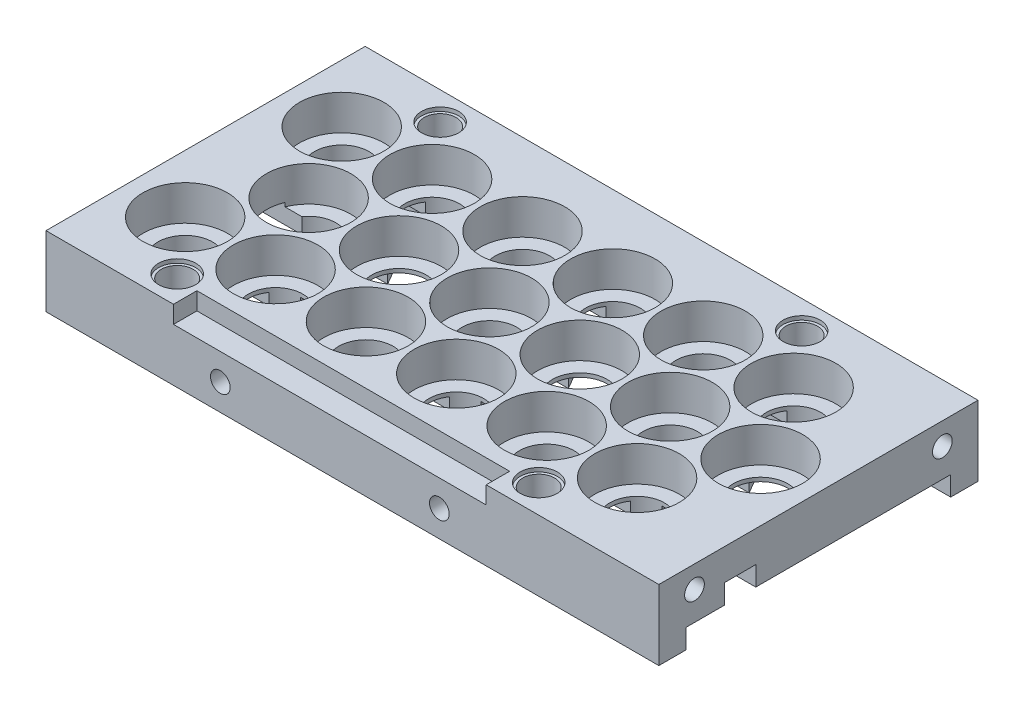
from build123d import *

# Parameters (mm, degrees)
BOSS_EXTRUDE2_DEPTH      = 11
BOSS_EXTRUDE2_DEPTH_BACK = 2
SKETCH1_W                = 156.975
SKETCH1_H                = 81.746976195
SKETCH1_R                = 10.825
BOSS_EXTRUDE3_DEPTH      = 2
BOSS_EXTRUDE3_DEPTH_BACK = 2
SKETCH1_3_R              = 10.825
SKETCH1_3_R_2            = 7
CUT_EXTRUDE3_REACH       = 157.2
SKETCH9_R                = 4.0767
SKETCH10_R               = 4.7625
CUT_EXTRUDE4_DEPTH       = 1
SKETCH13_R               = 6.5
BOSS_EXTRUDE7_DEPTH      = 5
CUT_EXTRUDE1_DEPTH       = 3
SKETCH19_W               = 80.1
SKETCH19_H               = 4.475
CUT_EXTRUDE6_DEPTH       = 6
SKETCH20_R               = 2.525
CUT_EXTRUDE7_DEPTH       = 6.604
SKETCH22_R               = 2.525
CUT_EXTRUDE8_DEPTH       = 6.604
SKETCH26_R               = 1.9431
CUT_EXTRUDE9_DEPTH       = 5
CUT_EXTRUDE10_DEPTH      = 5
SKETCH28_R               = 1.9431
CUT_EXTRUDE11_DEPTH      = 5


with BuildPart() as part:
    # Sketch1 → Boss-Extrude2 (new, two sides: drawn at the far end of the back side and taken through both)
    with BuildSketch(Plane(origin=(0, 0, 0), x_dir=(1, 0, 0), z_dir=(0, 1, 0)).offset(-BOSS_EXTRUDE2_DEPTH_BACK)):
        with Locations((63.6625, -20.048488098)):
            Rectangle(SKETCH1_W, SKETCH1_H)
        with Locations((0, -40.096976195)):
            Circle(SKETCH1_R, mode=Mode.SUBTRACT)
        with Locations((23.15, -40.096976195)):
            Circle(SKETCH1_R, mode=Mode.SUBTRACT)
        with Locations((46.3, -40.096976195)):
            Circle(SKETCH1_R, mode=Mode.SUBTRACT)
        with Locations((69.45, -40.096976195)):
            Circle(SKETCH1_R, mode=Mode.SUBTRACT)
        with Locations((92.6, -40.096976195)):
            Circle(SKETCH1_R, mode=Mode.SUBTRACT)
        with Locations((115.75, -40.096976195)):
            Circle(SKETCH1_R, mode=Mode.SUBTRACT)
        with Locations((11.575, -20.048488098)):
            Circle(SKETCH1_R, mode=Mode.SUBTRACT)
        Circle(SKETCH1_R, mode=Mode.SUBTRACT)
        with Locations((23.15, 0)):
            Circle(SKETCH1_R, mode=Mode.SUBTRACT)
        with Locations((34.725, -20.048488098)):
            Circle(SKETCH1_R, mode=Mode.SUBTRACT)
        with Locations((57.875, -20.048488098)):
            Circle(SKETCH1_R, mode=Mode.SUBTRACT)
        with Locations((46.3, 0)):
            Circle(SKETCH1_R, mode=Mode.SUBTRACT)
        with Locations((81.025, -20.048488098)):
            Circle(SKETCH1_R, mode=Mode.SUBTRACT)
        with Locations((69.45, 0)):
            Circle(SKETCH1_R, mode=Mode.SUBTRACT)
        with Locations((92.6, 0)):
            Circle(SKETCH1_R, mode=Mode.SUBTRACT)
        with Locations((104.175, -20.048488098)):
            Circle(SKETCH1_R, mode=Mode.SUBTRACT)
        with Locations((127.325, -20.048488098)):
            Circle(SKETCH1_R, mode=Mode.SUBTRACT)
        with Locations((115.75, 0)):
            Circle(SKETCH1_R, mode=Mode.SUBTRACT)
    extrude(amount=BOSS_EXTRUDE2_DEPTH + BOSS_EXTRUDE2_DEPTH_BACK)

    # Sketch1<3> → Boss-Extrude3 (add, two sides: drawn at the far end of the back side and taken through both)
    # profile 1 of 18: a face of its own
    with BuildSketch(Plane(origin=(0, 0, 0), x_dir=(1, 0, 0), z_dir=(0, 1, 0)).offset(-BOSS_EXTRUDE3_DEPTH_BACK)):
        Circle(SKETCH1_3_R)
        Circle(SKETCH1_3_R_2, mode=Mode.SUBTRACT)
    # profile 2 of 18: a face of its own
    with BuildSketch(Plane(origin=(0, 0, 0), x_dir=(1, 0, 0), z_dir=(0, 1, 0)).offset(-BOSS_EXTRUDE3_DEPTH_BACK)):
        with Locations((11.575, -20.048488098)):
            Circle(SKETCH1_3_R)
        with Locations((11.575, -20.048488098)):
            Circle(SKETCH1_3_R_2, mode=Mode.SUBTRACT)
    # profile 3 of 18: a face of its own
    with BuildSketch(Plane(origin=(0, 0, 0), x_dir=(1, 0, 0), z_dir=(0, 1, 0)).offset(-BOSS_EXTRUDE3_DEPTH_BACK)):
        with Locations((0, -40.096976195)):
            Circle(SKETCH1_3_R)
        with Locations((0, -40.096976195)):
            Circle(SKETCH1_3_R_2, mode=Mode.SUBTRACT)
    # profile 4 of 18: a face of its own
    with BuildSketch(Plane(origin=(0, 0, 0), x_dir=(1, 0, 0), z_dir=(0, 1, 0)).offset(-BOSS_EXTRUDE3_DEPTH_BACK)):
        with Locations((23.15, 0)):
            Circle(SKETCH1_3_R)
        with Locations((23.15, 0)):
            Circle(SKETCH1_3_R_2, mode=Mode.SUBTRACT)
    # profile 5 of 18: a face of its own
    with BuildSketch(Plane(origin=(0, 0, 0), x_dir=(1, 0, 0), z_dir=(0, 1, 0)).offset(-BOSS_EXTRUDE3_DEPTH_BACK)):
        with Locations((34.725, -20.048488098)):
            Circle(SKETCH1_3_R)
        with Locations((34.725, -20.048488098)):
            Circle(SKETCH1_3_R_2, mode=Mode.SUBTRACT)
    # profile 6 of 18: a face of its own
    with BuildSketch(Plane(origin=(0, 0, 0), x_dir=(1, 0, 0), z_dir=(0, 1, 0)).offset(-BOSS_EXTRUDE3_DEPTH_BACK)):
        with Locations((23.15, -40.096976195)):
            Circle(SKETCH1_3_R)
        with Locations((23.15, -40.096976195)):
            Circle(SKETCH1_3_R_2, mode=Mode.SUBTRACT)
    # profile 7 of 18: a face of its own
    with BuildSketch(Plane(origin=(0, 0, 0), x_dir=(1, 0, 0), z_dir=(0, 1, 0)).offset(-BOSS_EXTRUDE3_DEPTH_BACK)):
        with Locations((46.3, 0)):
            Circle(SKETCH1_3_R)
        with Locations((46.3, 0)):
            Circle(SKETCH1_3_R_2, mode=Mode.SUBTRACT)
    # profile 8 of 18: a face of its own
    with BuildSketch(Plane(origin=(0, 0, 0), x_dir=(1, 0, 0), z_dir=(0, 1, 0)).offset(-BOSS_EXTRUDE3_DEPTH_BACK)):
        with Locations((57.875, -20.048488098)):
            Circle(SKETCH1_3_R)
        with Locations((57.875, -20.048488098)):
            Circle(SKETCH1_3_R_2, mode=Mode.SUBTRACT)
    # profile 9 of 18: a face of its own
    with BuildSketch(Plane(origin=(0, 0, 0), x_dir=(1, 0, 0), z_dir=(0, 1, 0)).offset(-BOSS_EXTRUDE3_DEPTH_BACK)):
        with Locations((46.3, -40.096976195)):
            Circle(SKETCH1_3_R)
        with Locations((46.3, -40.096976195)):
            Circle(SKETCH1_3_R_2, mode=Mode.SUBTRACT)
    # profile 10 of 18: a face of its own
    with BuildSketch(Plane(origin=(0, 0, 0), x_dir=(1, 0, 0), z_dir=(0, 1, 0)).offset(-BOSS_EXTRUDE3_DEPTH_BACK)):
        with Locations((69.45, 0)):
            Circle(SKETCH1_3_R)
        with Locations((69.45, 0)):
            Circle(SKETCH1_3_R_2, mode=Mode.SUBTRACT)
    # profile 11 of 18: a face of its own
    with BuildSketch(Plane(origin=(0, 0, 0), x_dir=(1, 0, 0), z_dir=(0, 1, 0)).offset(-BOSS_EXTRUDE3_DEPTH_BACK)):
        with Locations((81.025, -20.048488098)):
            Circle(SKETCH1_3_R)
        with Locations((81.025, -20.048488098)):
            Circle(SKETCH1_3_R_2, mode=Mode.SUBTRACT)
    # profile 12 of 18: a face of its own
    with BuildSketch(Plane(origin=(0, 0, 0), x_dir=(1, 0, 0), z_dir=(0, 1, 0)).offset(-BOSS_EXTRUDE3_DEPTH_BACK)):
        with Locations((69.45, -40.096976195)):
            Circle(SKETCH1_3_R)
        with Locations((69.45, -40.096976195)):
            Circle(SKETCH1_3_R_2, mode=Mode.SUBTRACT)
    # profile 13 of 18: a face of its own
    with BuildSketch(Plane(origin=(0, 0, 0), x_dir=(1, 0, 0), z_dir=(0, 1, 0)).offset(-BOSS_EXTRUDE3_DEPTH_BACK)):
        with Locations((92.6, 0)):
            Circle(SKETCH1_3_R)
        with Locations((92.6, 0)):
            Circle(SKETCH1_3_R_2, mode=Mode.SUBTRACT)
    # profile 14 of 18: a face of its own
    with BuildSketch(Plane(origin=(0, 0, 0), x_dir=(1, 0, 0), z_dir=(0, 1, 0)).offset(-BOSS_EXTRUDE3_DEPTH_BACK)):
        with Locations((104.175, -20.048488098)):
            Circle(SKETCH1_3_R)
        with Locations((104.175, -20.048488098)):
            Circle(SKETCH1_3_R_2, mode=Mode.SUBTRACT)
    # profile 15 of 18: a face of its own
    with BuildSketch(Plane(origin=(0, 0, 0), x_dir=(1, 0, 0), z_dir=(0, 1, 0)).offset(-BOSS_EXTRUDE3_DEPTH_BACK)):
        with Locations((92.6, -40.096976195)):
            Circle(SKETCH1_3_R)
        with Locations((92.6, -40.096976195)):
            Circle(SKETCH1_3_R_2, mode=Mode.SUBTRACT)
    # profile 16 of 18: a face of its own
    with BuildSketch(Plane(origin=(0, 0, 0), x_dir=(1, 0, 0), z_dir=(0, 1, 0)).offset(-BOSS_EXTRUDE3_DEPTH_BACK)):
        with Locations((115.75, 0)):
            Circle(SKETCH1_3_R)
        with Locations((115.75, 0)):
            Circle(SKETCH1_3_R_2, mode=Mode.SUBTRACT)
    # profile 17 of 18: a face of its own
    with BuildSketch(Plane(origin=(0, 0, 0), x_dir=(1, 0, 0), z_dir=(0, 1, 0)).offset(-BOSS_EXTRUDE3_DEPTH_BACK)):
        with Locations((127.325, -20.048488098)):
            Circle(SKETCH1_3_R)
        with Locations((127.325, -20.048488098)):
            Circle(SKETCH1_3_R_2, mode=Mode.SUBTRACT)
    # profile 18 of 18: a face of its own
    with BuildSketch(Plane(origin=(0, 0, 0), x_dir=(1, 0, 0), z_dir=(0, 1, 0)).offset(-BOSS_EXTRUDE3_DEPTH_BACK)):
        with Locations((115.75, -40.096976195)):
            Circle(SKETCH1_3_R)
        with Locations((115.75, -40.096976195)):
            Circle(SKETCH1_3_R_2, mode=Mode.SUBTRACT)
    extrude(amount=BOSS_EXTRUDE3_DEPTH + BOSS_EXTRUDE3_DEPTH_BACK)

    # Sketch9 → Cut-Extrude3 (cut, up to next)
    with BuildSketch(Plane(origin=(0, 11, 0), x_dir=(1, 0, 0), z_dir=(0, 1, 0)), mode=Mode.PRIVATE) as cut_extrude3_sk1:
        with Locations((11.575, 13.625)):
            Circle(SKETCH9_R)
    cut_extrude3_tool1 = extrude(cut_extrude3_sk1.sketch, amount=-CUT_EXTRUDE3_REACH, mode=Mode.PRIVATE) & part.part
    # Sketch9 → Cut-Extrude3 (cut, up to next)
    with BuildSketch(Plane(origin=(0, 11, 0), x_dir=(1, 0, 0), z_dir=(0, 1, 0)), mode=Mode.PRIVATE) as cut_extrude3_sk2:
        with Locations((11.575, -53.721976195)):
            Circle(SKETCH9_R)
    cut_extrude3_tool2 = extrude(cut_extrude3_sk2.sketch, amount=-CUT_EXTRUDE3_REACH, mode=Mode.PRIVATE) & part.part
    # Sketch9 → Cut-Extrude3 (cut, up to next)
    with BuildSketch(Plane(origin=(0, 11, 0), x_dir=(1, 0, 0), z_dir=(0, 1, 0)), mode=Mode.PRIVATE) as cut_extrude3_sk3:
        with Locations((104.175, -53.721976195)):
            Circle(SKETCH9_R)
    cut_extrude3_tool3 = extrude(cut_extrude3_sk3.sketch, amount=-CUT_EXTRUDE3_REACH, mode=Mode.PRIVATE) & part.part
    # Sketch9 → Cut-Extrude3 (cut, up to next)
    with BuildSketch(Plane(origin=(0, 11, 0), x_dir=(1, 0, 0), z_dir=(0, 1, 0)), mode=Mode.PRIVATE) as cut_extrude3_sk4:
        with Locations((104.175, 13.625)):
            Circle(SKETCH9_R)
    cut_extrude3_tool4 = extrude(cut_extrude3_sk4.sketch, amount=-CUT_EXTRUDE3_REACH, mode=Mode.PRIVATE) & part.part
    add(cut_extrude3_tool1.solids().sort_by_distance((11.575, 11, -13.625))[0], mode=Mode.SUBTRACT)
    add(cut_extrude3_tool2.solids().sort_by_distance((11.575, 11, 53.721976))[0], mode=Mode.SUBTRACT)
    add(cut_extrude3_tool3.solids().sort_by_distance((104.175, 11, 53.721976))[0], mode=Mode.SUBTRACT)
    add(cut_extrude3_tool4.solids().sort_by_distance((104.175, 11, -13.625))[0], mode=Mode.SUBTRACT)

    # Sketch10 → Cut-Extrude4 (cut)
    with BuildSketch(Plane(origin=(0, 11, 0), x_dir=(1, 0, 0), z_dir=(0, 1, 0))):
        with Locations((11.575, 13.625)):
            Circle(SKETCH10_R)
        with Locations((104.175, 13.625)):
            Circle(SKETCH10_R)
        with Locations((104.175, -53.721976195)):
            Circle(SKETCH10_R)
        with Locations((11.575, -53.721976195)):
            Circle(SKETCH10_R)
    extrude(amount=-CUT_EXTRUDE4_DEPTH, mode=Mode.SUBTRACT)

    # Sketch13 → Boss-Extrude7 (add)
    # profile 1 of 2: a face of its own
    with BuildSketch(Plane.XZ.offset(2)):
        with BuildLine():
            ThreePointArc((3.577500391, 53.921976195), (11.575, 45.721976195), (19.572499609, 53.921976195))
            Line((19.572499609, 53.921976195), (96.177500391, 53.921976195))
            ThreePointArc((96.177500391, 53.921976195), (104.175, 45.721976195), (112.172499609, 53.921976195))
            Line((112.172499609, 53.921976195), (142.15, 53.921976195))
            Line((142.15, 53.921976195), (142.15, 60.921976195))
            Line((142.15, 60.921976195), (-14.825, 60.921976195))
            Line((-14.825, 60.921976195), (-14.825, 53.921976195))
            Line((-14.825, 53.921976195), (3.577500391, 53.921976195))
        make_face()
        with Locations((11.575, 53.721976195)):
            Circle(SKETCH13_R, mode=Mode.SUBTRACT)
        with Locations((104.175, 53.721976195)):
            Circle(SKETCH13_R, mode=Mode.SUBTRACT)
    # profile 2 of 2: a face of its own
    with BuildSketch(Plane.XZ.offset(2)):
        with BuildLine():
            Line((-14.825, -13.825), (-14.825, -20.825))
            Line((-14.825, -20.825), (142.15, -20.825))
            Line((142.15, -20.825), (142.15, -13.825))
            Line((142.15, -13.825), (112.172499609, -13.825))
            ThreePointArc((112.172499609, -13.825), (104.175, -5.625), (96.177500391, -13.825))
            Line((96.177500391, -13.825), (19.572499609, -13.825))
            ThreePointArc((19.572499609, -13.825), (11.575, -5.625), (3.577500391, -13.825))
            Line((3.577500391, -13.825), (-14.825, -13.825))
        make_face()
        with Locations((11.575, -13.625)):
            Circle(SKETCH13_R, mode=Mode.SUBTRACT)
        with Locations((104.175, -13.625)):
            Circle(SKETCH13_R, mode=Mode.SUBTRACT)
    extrude(amount=BOSS_EXTRUDE7_DEPTH)

    # Sketch2 → Cut-Extrude1 (cut)
    with BuildSketch(Plane.XZ.offset(2)):
        with BuildLine():
            Line((23.15, 44.096976195), (0, 44.096976195))
            ThreePointArc((0, 44.096976195), (-4, 40.096976195), (0, 36.096976195))
            Line((0, 36.096976195), (20.840598923, 36.096976195))
            Line((20.840598923, 36.096976195), (27.79679677, 24.048488098))
            Line((27.79679677, 24.048488098), (13.884401077, 24.048488098))
            Line((13.884401077, 24.048488098), (15.039101615, 22.048488098))
            ThreePointArc((15.039101615, 22.048488098), (15.575, 20.048488098), (15.039101615, 18.048488098))
            Line((15.039101615, 18.048488098), (13.884401077, 16.048488098))
            Line((13.884401077, 16.048488098), (27.79679677, 16.048488098))
            Line((27.79679677, 16.048488098), (20.840598923, 4))
            Line((20.840598923, 4), (0, 4))
            ThreePointArc((0, 4), (-4, 0), (0, -4))
            Line((0, -4), (23.14999999, -4))
            ThreePointArc((23.14999999, -4), (25.149999995, -3.464101618), (26.614101615, -2))
            Line((26.614101615, -2), (37.034401077, 16.048488098))
            Line((37.034401077, 16.048488098), (34.725, 16.048488098))
            ThreePointArc((34.725, 16.048488098), (32.725, 16.584386482), (31.260898385, 18.048488098))
            Line((31.260898385, 18.048488098), (30.106197846, 20.048488098))
            Line((30.106197846, 20.048488098), (31.260898385, 22.048488098))
            ThreePointArc((31.260898385, 22.048488098), (32.725, 23.512589713), (34.725, 24.048488098))
            Line((34.725, 24.048488098), (37.034401077, 24.048488098))
            Line((37.034401077, 24.048488098), (26.614101615, 42.096976195))
            ThreePointArc((26.614101615, 42.096976195), (25.15, 43.56107781), (23.15, 44.096976195))
        make_face()
        with BuildLine():
            Line((69.45, 44.096976195), (46.3, 44.096976195))
            ThreePointArc((46.3, 44.096976195), (42.835898385, 42.096976195), (42.835898385, 38.096976195))
            Line((42.835898385, 38.096976195), (43.990598923, 36.096976195))
            Line((43.990598923, 36.096976195), (67.140598923, 36.096976195))
            Line((67.140598923, 36.096976195), (74.09679677, 24.048488098))
            Line((74.09679677, 24.048488098), (60.184401077, 24.048488098))
            Line((60.184401077, 24.048488098), (61.339101615, 22.048488098))
            ThreePointArc((61.339101615, 22.048488098), (61.875, 20.048488098), (61.339101615, 18.048488098))
            Line((61.339101615, 18.048488098), (60.184401077, 16.048488098))
            Line((60.184401077, 16.048488098), (74.09679677, 16.048488098))
            Line((74.09679677, 16.048488098), (67.140598923, 4))
            Line((67.140598923, 4), (43.990598923, 4))
            Line((43.990598923, 4), (42.835898385, 2))
            ThreePointArc((42.835898385, 2), (42.835898385, -2), (46.3, -4))
            Line((46.3, -4), (69.45, -4))
            ThreePointArc((69.45, -4), (71.45, -3.464101615), (72.914101615, -2))
            Line((72.914101615, -2), (83.334401077, 16.048488098))
            Line((83.334401077, 16.048488098), (81.025, 16.048488098))
            ThreePointArc((81.025, 16.048488098), (79.025, 16.584386482), (77.560898385, 18.048488098))
            Line((77.560898385, 18.048488098), (76.406197846, 20.048488098))
            Line((76.406197846, 20.048488098), (77.560898385, 22.048488098))
            ThreePointArc((77.560898385, 22.048488098), (79.025, 23.512589713), (81.025, 24.048488098))
            Line((81.025, 24.048488098), (83.334401077, 24.048488098))
            Line((83.334401077, 24.048488098), (72.914101615, 42.096976195))
            ThreePointArc((72.914101615, 42.096976195), (71.45, 43.56107781), (69.45, 44.096976195))
        make_face()
        with BuildLine():
            Line((115.75, 44.096976195), (92.6, 44.096976195))
            ThreePointArc((92.6, 44.096976195), (89.135898385, 42.096976195), (89.135898385, 38.096976195))
            Line((89.135898385, 38.096976195), (90.290598923, 36.096976195))
            Line((90.290598923, 36.096976195), (113.440598923, 36.096976195))
            Line((113.440598923, 36.096976195), (112.285898385, 38.096976195))
            ThreePointArc((112.285898385, 38.096976195), (112.285898385, 42.096976195), (115.75, 44.096976195))
        make_face()
        with BuildLine():
            Line((130.789101615, 22.048488098), (119.214101615, 42.096976195))
            ThreePointArc((119.214101615, 42.096976195), (119.214101615, 38.096976195), (115.75, 36.096976195))
            Line((115.75, 36.096976195), (113.440598923, 36.096976195))
            Line((113.440598923, 36.096976195), (120.39679677, 24.048488098))
            Line((120.39679677, 24.048488098), (106.484401077, 24.048488098))
            Line((106.484401077, 24.048488098), (107.639101615, 22.048488098))
            ThreePointArc((107.639101615, 22.048488098), (108.175, 20.048488098), (107.639101615, 18.048488098))
            Line((107.639101615, 18.048488098), (106.484401077, 16.048488098))
            Line((106.484401077, 16.048488098), (120.39679677, 16.048488098))
            Line((120.39679677, 16.048488098), (113.440598923, 4))
            Line((113.440598923, 4), (115.75, 4))
            ThreePointArc((115.75, 4), (119.214101615, 2), (119.214101615, -2))
            Line((119.214101615, -2), (130.789101615, 18.048488098))
            ThreePointArc((130.789101615, 18.048488098), (127.325, 16.048488098), (123.860898385, 18.048488098))
            Line((123.860898385, 18.048488098), (122.706197846, 20.048488098))
            Line((122.706197846, 20.048488098), (123.860898385, 22.048488098))
            ThreePointArc((123.860898385, 22.048488098), (127.325, 24.048488098), (130.789101615, 22.048488098))
        make_face()
        with BuildLine():
            Line((113.440598923, 4), (90.290598923, 4))
            Line((90.290598923, 4), (89.135898385, 2))
            ThreePointArc((89.135898385, 2), (89.135898385, -2), (92.6, -4))
            Line((92.6, -4), (115.75, -4))
            ThreePointArc((115.75, -4), (112.285898385, -2), (112.285898385, 2))
            Line((112.285898385, 2), (113.440598923, 4))
        make_face()
    extrude(amount=-CUT_EXTRUDE1_DEPTH, mode=Mode.SUBTRACT)

    # Sketch19 → Cut-Extrude6 (cut)
    with BuildSketch(Plane.XY.offset(60.921976195)):
        with Locations((57.875, 8.7625)):
            Rectangle(SKETCH19_W, SKETCH19_H)
    extrude(amount=-CUT_EXTRUDE6_DEPTH, mode=Mode.SUBTRACT)

    # Sketch20 → Cut-Extrude7 (cut)
    with BuildSketch(Plane.XY.offset(60.921976195)):
        with Locations((29.825, -0.2375)):
            Circle(SKETCH20_R)
        with Locations((85.925, -0.2375)):
            Circle(SKETCH20_R)
    extrude(amount=-CUT_EXTRUDE7_DEPTH, mode=Mode.SUBTRACT)

    # Sketch22 → Cut-Extrude8 (cut)
    with BuildSketch(Plane(origin=(142.15, 0, 0), x_dir=(0, 0, -1), z_dir=(1, 0, 0))):
        with Locations((-51.798488098, 5.325)):
            Circle(SKETCH22_R)
        with Locations((11.701511902, 5.325)):
            Circle(SKETCH22_R)
    extrude(amount=-CUT_EXTRUDE8_DEPTH, mode=Mode.SUBTRACT)

    # Sketch26 → Cut-Extrude9 (cut)
    with BuildSketch(Plane.XZ.offset(2)):
        with Locations((132.15, -8.9125)):
            Circle(SKETCH26_R)
        with Locations((57.875, -8.9125)):
            Circle(SKETCH26_R)
        with Locations((-10.825, -8.9125)):
            Circle(SKETCH26_R)
        with Locations((-10.825, 49.009476195)):
            Circle(SKETCH26_R)
        with Locations((57.875, 49.009476195)):
            Circle(SKETCH26_R)
        with Locations((132.15, 49.009476195)):
            Circle(SKETCH26_R)
    extrude(amount=-CUT_EXTRUDE9_DEPTH, mode=Mode.SUBTRACT)

    # Sketch27 → Cut-Extrude10 (cut)
    with BuildSketch(Plane.XZ.offset(2)):
        with BuildLine():
            Line((11.575, 16.048488098), (-14.825, 16.048488098))
            ThreePointArc((-14.825, 16.048488098), (-18.825, 20.048488098), (-14.825, 24.048488098))
            Line((-14.825, 24.048488098), (11.575, 24.048488098))
            ThreePointArc((11.575, 24.048488098), (15.575, 20.048488098), (11.575, 16.048488098))
        make_face()
        with BuildLine():
            Line((115.75, 44.096976195), (142.15, 44.096976195))
            ThreePointArc((142.15, 44.096976195), (146.15, 40.096976195), (142.15, 36.096976195))
            Line((142.15, 36.096976195), (115.75, 36.096976195))
            ThreePointArc((115.75, 36.096976195), (111.75, 40.096976195), (115.75, 44.096976195))
        make_face()
    extrude(amount=-CUT_EXTRUDE10_DEPTH, mode=Mode.SUBTRACT)

    # Sketch28 → Cut-Extrude11 (cut)
    with BuildSketch(Plane.XZ.offset(-3)):
        with Locations((-3.25, 20.048488098)):
            Circle(SKETCH28_R)
        with Locations((-10.825, 20.048488098)):
            Circle(SKETCH28_R)
        with Locations((138.15, 40.096976195)):
            Circle(SKETCH28_R)
        with Locations((130.575, 40.096976195)):
            Circle(SKETCH28_R)
    extrude(amount=-CUT_EXTRUDE11_DEPTH, mode=Mode.SUBTRACT)


solid = part.part
